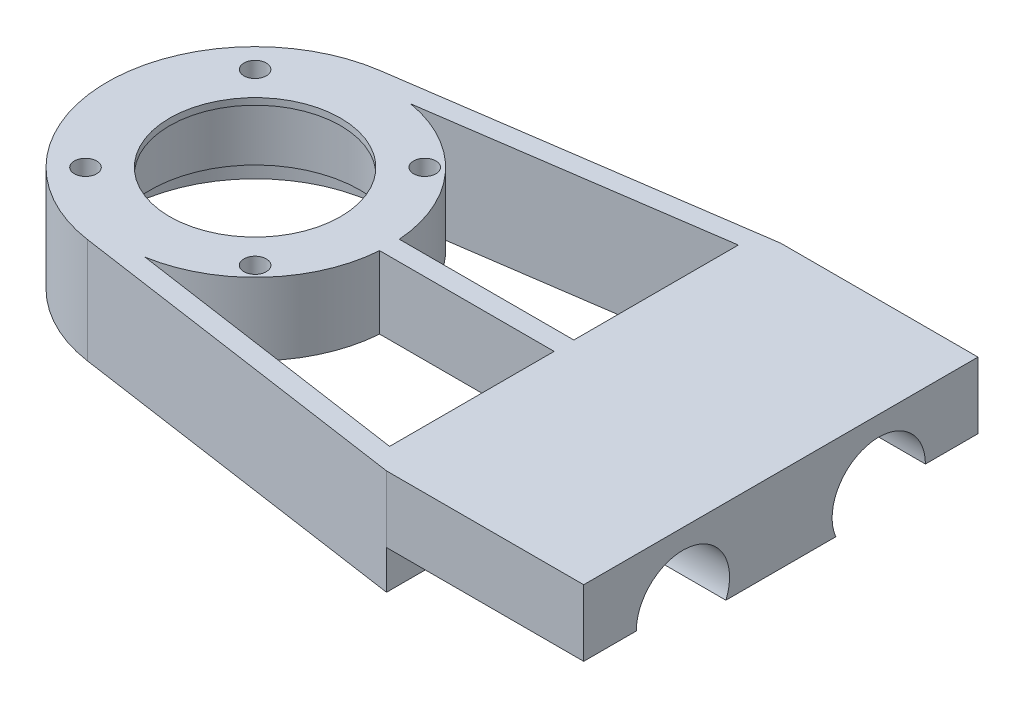
from build123d import *

# Parameters (mm, degrees)
EXTRUDE_1_DEPTH      = 16
SKETCH_2_R           = 16
CUT_EXTRUDE_1_DEPTH  = 15
SKETCH_3_R           = 13
CUT_EXTRUDE_2_DEPTH  = 120.713198938
SKETCH_4_R           = 20.5
CUT_EXTRUDE_3_DEPTH  = 5
HOLE_WIZARD_M32_D    = 3.4
CUT_EXTRUDE_8_DEPTH  = 30
CUT_EXTRUDE_11_DEPTH = 120.842605112
EXTRUDE_2_DEPTH      = 11


with BuildPart() as part:
    # Эскиз1 → Бобышка-Вытянуть1 (new body)
    with BuildSketch(Plane(origin=(0, 0, 0), x_dir=(1, 0, 0), z_dir=(0, 1, 0))):
        with BuildLine():
            Line((0, 0), (0, 60))
            Line((0, 60), (-30, 60))
            Line((-30, 60), (-83.234756238, 52.266260397))
            ThreePointArc((-83.234756238, 52.266260397), (-102.5, 30), (-83.234756238, 7.733739603))
            Line((-83.234756238, 7.733739603), (-30, 0))
            Line((-30, 0), (0, 0))
        make_face()
    extrude(amount=EXTRUDE_1_DEPTH)

    # Эскиз2 → Вырез-Вытянуть1 (cut)
    with BuildSketch(Plane.XZ):
        with Locations(Location((-80, -30, 0), (0, 0, 270))):
            Circle(SKETCH_2_R)
    extrude(amount=-CUT_EXTRUDE_1_DEPTH, mode=Mode.SUBTRACT)

    # Эскиз3 → Вырез-Вытянуть2 (cut, through all)
    with BuildSketch(Plane.XZ.offset(-15)):
        with Locations(Location((-80, -30, 0), (0, 0, 270))):
            Circle(SKETCH_3_R)
    extrude(amount=-CUT_EXTRUDE_2_DEPTH, mode=Mode.SUBTRACT)

    # Эскиз4 → Вырез-Вытянуть3 (cut)
    with BuildSketch(Plane.XZ):
        with Locations(Location((-80, -30, 0), (0, 0, 270))):
            Circle(SKETCH_4_R)
    extrude(amount=-CUT_EXTRUDE_3_DEPTH, mode=Mode.SUBTRACT)

    # Отверстие с зазором M32 (through all)
    with Locations(Plane(origin=(0, 5, 0), x_dir=(-1, 0, 0), z_dir=(0, -1, 0))):
        with Locations((92.904698757, 17.095301243), (67.095301243, 17.095301243), (67.095301243, 42.904698757), (92.904698757, 42.904698757)):
            Hole(HOLE_WIZARD_M32_D / 2)

    # Эскиз8 → Вырез-Вытянуть8 (cut)
    with BuildSketch(Plane(origin=(0, 0, 0), x_dir=(0, 0, -1), z_dir=(1, 0, 0))):
        with BuildLine():
            Line((38.359861864, 3.136561351), (21.640138136, 3.136561351))
            ThreePointArc((21.640138136, 3.136561351), (16.509790629, 12.858627047), (8, 5.9))
            Line((8, 5.9), (0, 5.9))
            Line((0, 5.9), (0, 0))
            Line((0, 0), (60, 0))
            Line((60, 0), (60, 5.9))
            Line((60, 5.9), (52, 5.9))
            ThreePointArc((52, 5.9), (43.490209371, 12.858627047), (38.359861864, 3.136561351))
        make_face()
    extrude(amount=-CUT_EXTRUDE_8_DEPTH, mode=Mode.SUBTRACT)

    # Эскиз14 → Вырез-Вытянуть11 (cut, through all)
    with BuildSketch(Plane.XZ):
        with BuildLine():
            Line((-33, -56.53267916), (-76.544602266, -50.206687668))
            ThreePointArc((-76.544602266, -50.206687668), (-59.5, -30), (-76.544602266, -9.793312332))
            Line((-76.544602266, -9.793312332), (-33, -3.46732084))
            Line((-33, -3.46732084), (-33, -56.53267916))
        make_face()
    extrude(amount=-CUT_EXTRUDE_11_DEPTH, mode=Mode.SUBTRACT)

    # Эскиз15 → Бобышка-Вытянуть2 (add, through all)
    with BuildSketch(Plane.XZ.offset(-5)):
        with BuildLine():
            Line((-59.5549517, -31.5), (-33, -31.5))
            Line((-33, -31.5), (-33, -28.5))
            Line((-33, -28.5), (-59.5549517, -28.5))
            ThreePointArc((-59.5549517, -28.5), (-59.5, -30), (-59.5549517, -31.5))
        make_face()
    extrude(amount=-EXTRUDE_2_DEPTH)


solid = part.part
